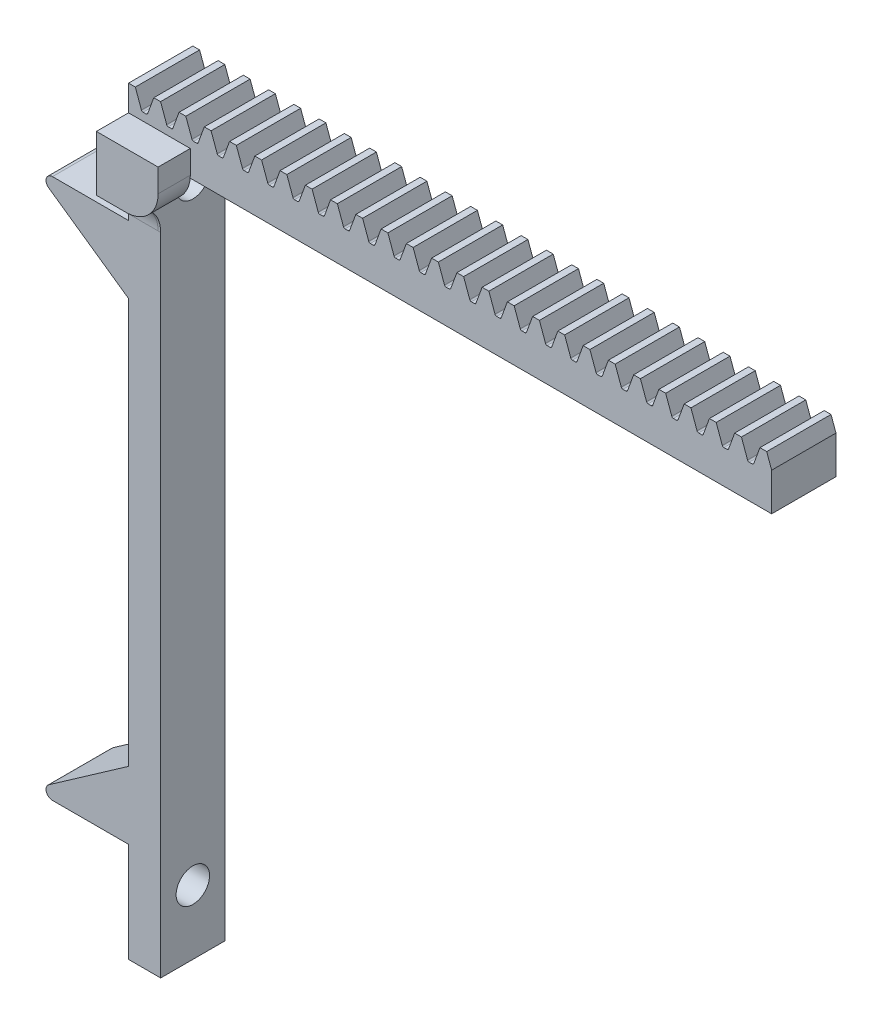
from build123d import *

# Parameters (mm, degrees)
SKETCH1_W           = 127
SKETCH1_H           = 10.16
BOSS_EXTRUDE1_DEPTH = 6.35
CUT_EXTRUDE1_DEPTH  = 12.7
FILLET3_R           = 0.320981709
LPATTERN4_START     = -6.35
LPATTERN4_DEPTH     = 12.7
SKETCH3_W           = 6.35
SKETCH3_H           = 12.7
BOSS_EXTRUDE2_DEPTH = 139.7
SKETCH4_R           = 3.302
CUT_EXTRUDE2_DEPTH  = 133.35
BOSS_EXTRUDE3_DEPTH = 12.7
FILLET6_R           = 1.27
SKETCH8_W           = 12.192
SKETCH8_H           = 10.922
BOSS_EXTRUDE4_DEPTH = 6.35
FILLET7_R           = 6.35
FILLET8_R           = 6.35


# Read off the part's stored shape, not the designer's step: LPattern4
with BuildPart() as part:
    # Sketch1 → Boss-Extrude1 (new, symmetric)
    with BuildSketch(Plane.XY):
        Rectangle(SKETCH1_W, SKETCH1_H)
    extrude(amount=BOSS_EXTRUDE1_DEPTH, both=True)

    # Sketch2 → Cut-Extrude1 (cut)
    with BuildSketch(Plane.XY.offset(6.35)):
        Polygon((-62.161960494, 5.08), (-60.872304763, 1.5367), (-59.802365731, 1.5367), (-58.51271, 5.08), align=None)
    extrude(amount=-CUT_EXTRUDE1_DEPTH, mode=Mode.SUBTRACT)

    # Fillet3
    fillet3_edges = [part.edges().sort_by_distance(p)[0] for p in [
        (-59.802365731, 1.5367, 0),
        (-60.872304763, 1.5367, 0),
    ]]
    fillet(fillet3_edges, radius=FILLET3_R)

    # LPattern4 outline → LPattern4 (cut)
    with BuildSketch(Plane.XY.offset(LPATTERN4_START)):
        with BuildLine():
            ThreePointArc((-55.961885094, 1.747899499), (-55.844368495, 1.594748886), (-55.66026095, 1.5367))
            Line((-55.66026095, 1.5367), (-55.039829544, 1.5367))
            ThreePointArc((-55.039829544, 1.5367), (-54.855721999, 1.594748886), (-54.7382054, 1.747899499))
            Line((-54.7382054, 1.747899499), (-53.52542, 5.08))
            Line((-53.52542, 5.08), (-57.174670494, 5.08))
            Line((-57.174670494, 5.08), (-55.961885094, 1.747899499))
        make_face()
        Polygon((63.5, 5.08), (62.520289506, 5.08), (63.5, 2.388267541), align=None)
        with BuildLine():
            Line((61.18225, 5.08), (57.532999506, 5.08))
            Line((57.532999506, 5.08), (58.745784906, 1.747899499))
            ThreePointArc((58.745784906, 1.747899499), (58.863301505, 1.594748886), (59.04740905, 1.5367))
            Line((59.04740905, 1.5367), (59.667840456, 1.5367))
            ThreePointArc((59.667840456, 1.5367), (59.851948001, 1.594748886), (59.9694646, 1.747899499))
            Line((59.9694646, 1.747899499), (61.18225, 5.08))
        make_face()
        with BuildLine():
            Line((56.19496, 5.08), (52.545709506, 5.08))
            Line((52.545709506, 5.08), (53.758494906, 1.747899499))
            ThreePointArc((53.758494906, 1.747899499), (53.876011505, 1.594748886), (54.06011905, 1.5367))
            Line((54.06011905, 1.5367), (54.680550456, 1.5367))
            ThreePointArc((54.680550456, 1.5367), (54.864658001, 1.594748886), (54.9821746, 1.747899499))
            Line((54.9821746, 1.747899499), (56.19496, 5.08))
        make_face()
        with BuildLine():
            Line((51.20767, 5.08), (47.558419506, 5.08))
            Line((47.558419506, 5.08), (48.771204906, 1.747899499))
            ThreePointArc((48.771204906, 1.747899499), (48.888721505, 1.594748886), (49.07282905, 1.5367))
            Line((49.07282905, 1.5367), (49.693260456, 1.5367))
            ThreePointArc((49.693260456, 1.5367), (49.877368001, 1.594748886), (49.9948846, 1.747899499))
            Line((49.9948846, 1.747899499), (51.20767, 5.08))
        make_face()
        with BuildLine():
            Line((46.22038, 5.08), (42.571129506, 5.08))
            Line((42.571129506, 5.08), (43.783914906, 1.747899499))
            ThreePointArc((43.783914906, 1.747899499), (43.901431505, 1.594748886), (44.08553905, 1.5367))
            Line((44.08553905, 1.5367), (44.705970456, 1.5367))
            ThreePointArc((44.705970456, 1.5367), (44.890078001, 1.594748886), (45.0075946, 1.747899499))
            Line((45.0075946, 1.747899499), (46.22038, 5.08))
        make_face()
        with BuildLine():
            Line((41.23309, 5.08), (37.583839506, 5.08))
            Line((37.583839506, 5.08), (38.796624906, 1.747899499))
            ThreePointArc((38.796624906, 1.747899499), (38.914141505, 1.594748886), (39.09824905, 1.5367))
            Line((39.09824905, 1.5367), (39.718680456, 1.5367))
            ThreePointArc((39.718680456, 1.5367), (39.902788001, 1.594748886), (40.0203046, 1.747899499))
            Line((40.0203046, 1.747899499), (41.23309, 5.08))
        make_face()
        with BuildLine():
            Line((36.2458, 5.08), (32.596549506, 5.08))
            Line((32.596549506, 5.08), (33.809334906, 1.747899499))
            ThreePointArc((33.809334906, 1.747899499), (33.926851505, 1.594748886), (34.11095905, 1.5367))
            Line((34.11095905, 1.5367), (34.731390456, 1.5367))
            ThreePointArc((34.731390456, 1.5367), (34.915498001, 1.594748886), (35.0330146, 1.747899499))
            Line((35.0330146, 1.747899499), (36.2458, 5.08))
        make_face()
        with BuildLine():
            Line((31.25851, 5.08), (27.609259506, 5.08))
            Line((27.609259506, 5.08), (28.822044906, 1.747899499))
            ThreePointArc((28.822044906, 1.747899499), (28.939561505, 1.594748886), (29.12366905, 1.5367))
            Line((29.12366905, 1.5367), (29.744100456, 1.5367))
            ThreePointArc((29.744100456, 1.5367), (29.928208001, 1.594748886), (30.0457246, 1.747899499))
            Line((30.0457246, 1.747899499), (31.25851, 5.08))
        make_face()
        with BuildLine():
            Line((26.27122, 5.08), (22.621969506, 5.08))
            Line((22.621969506, 5.08), (23.834754906, 1.747899499))
            ThreePointArc((23.834754906, 1.747899499), (23.952271505, 1.594748886), (24.13637905, 1.5367))
            Line((24.13637905, 1.5367), (24.756810456, 1.5367))
            ThreePointArc((24.756810456, 1.5367), (24.940918001, 1.594748886), (25.0584346, 1.747899499))
            Line((25.0584346, 1.747899499), (26.27122, 5.08))
        make_face()
        with BuildLine():
            Line((21.28393, 5.08), (17.634679506, 5.08))
            Line((17.634679506, 5.08), (18.847464906, 1.747899499))
            ThreePointArc((18.847464906, 1.747899499), (18.964981505, 1.594748886), (19.14908905, 1.5367))
            Line((19.14908905, 1.5367), (19.769520456, 1.5367))
            ThreePointArc((19.769520456, 1.5367), (19.953628001, 1.594748886), (20.0711446, 1.747899499))
            Line((20.0711446, 1.747899499), (21.28393, 5.08))
        make_face()
        with BuildLine():
            Line((16.29664, 5.08), (12.647389506, 5.08))
            Line((12.647389506, 5.08), (13.860174906, 1.747899499))
            ThreePointArc((13.860174906, 1.747899499), (13.977691505, 1.594748886), (14.16179905, 1.5367))
            Line((14.16179905, 1.5367), (14.782230456, 1.5367))
            ThreePointArc((14.782230456, 1.5367), (14.966338001, 1.594748886), (15.0838546, 1.747899499))
            Line((15.0838546, 1.747899499), (16.29664, 5.08))
        make_face()
        with BuildLine():
            Line((11.30935, 5.08), (7.660099506, 5.08))
            Line((7.660099506, 5.08), (8.872884906, 1.747899499))
            ThreePointArc((8.872884906, 1.747899499), (8.990401505, 1.594748886), (9.17450905, 1.5367))
            Line((9.17450905, 1.5367), (9.794940456, 1.5367))
            ThreePointArc((9.794940456, 1.5367), (9.979048001, 1.594748886), (10.0965646, 1.747899499))
            Line((10.0965646, 1.747899499), (11.30935, 5.08))
        make_face()
        with BuildLine():
            Line((6.32206, 5.08), (2.672809506, 5.08))
            Line((2.672809506, 5.08), (3.885594906, 1.747899499))
            ThreePointArc((3.885594906, 1.747899499), (4.003111505, 1.594748886), (4.18721905, 1.5367))
            Line((4.18721905, 1.5367), (4.807650456, 1.5367))
            ThreePointArc((4.807650456, 1.5367), (4.991758001, 1.594748886), (5.1092746, 1.747899499))
            Line((5.1092746, 1.747899499), (6.32206, 5.08))
        make_face()
        with BuildLine():
            Line((1.33477, 5.08), (-2.314480494, 5.08))
            Line((-2.314480494, 5.08), (-1.101695094, 1.747899499))
            ThreePointArc((-1.101695094, 1.747899499), (-0.984178495, 1.594748886), (-0.80007095, 1.5367))
            Line((-0.80007095, 1.5367), (-0.179639544, 1.5367))
            ThreePointArc((-0.179639544, 1.5367), (0.004468001, 1.594748886), (0.1219846, 1.747899499))
            Line((0.1219846, 1.747899499), (1.33477, 5.08))
        make_face()
        with BuildLine():
            Line((-3.65252, 5.08), (-7.301770494, 5.08))
            Line((-7.301770494, 5.08), (-6.088985094, 1.747899499))
            ThreePointArc((-6.088985094, 1.747899499), (-5.971468495, 1.594748886), (-5.78736095, 1.5367))
            Line((-5.78736095, 1.5367), (-5.166929544, 1.5367))
            ThreePointArc((-5.166929544, 1.5367), (-4.982821999, 1.594748886), (-4.8653054, 1.747899499))
            Line((-4.8653054, 1.747899499), (-3.65252, 5.08))
        make_face()
        with BuildLine():
            Line((-8.63981, 5.08), (-12.289060494, 5.08))
            Line((-12.289060494, 5.08), (-11.076275094, 1.747899499))
            ThreePointArc((-11.076275094, 1.747899499), (-10.958758495, 1.594748886), (-10.77465095, 1.5367))
            Line((-10.77465095, 1.5367), (-10.154219544, 1.5367))
            ThreePointArc((-10.154219544, 1.5367), (-9.970111999, 1.594748886), (-9.8525954, 1.747899499))
            Line((-9.8525954, 1.747899499), (-8.63981, 5.08))
        make_face()
        with BuildLine():
            Line((-13.6271, 5.08), (-17.276350494, 5.08))
            Line((-17.276350494, 5.08), (-16.063565094, 1.747899499))
            ThreePointArc((-16.063565094, 1.747899499), (-15.946048495, 1.594748886), (-15.76194095, 1.5367))
            Line((-15.76194095, 1.5367), (-15.141509544, 1.5367))
            ThreePointArc((-15.141509544, 1.5367), (-14.957401999, 1.594748886), (-14.8398854, 1.747899499))
            Line((-14.8398854, 1.747899499), (-13.6271, 5.08))
        make_face()
        with BuildLine():
            Line((-18.61439, 5.08), (-22.263640494, 5.08))
            Line((-22.263640494, 5.08), (-21.050855094, 1.747899499))
            ThreePointArc((-21.050855094, 1.747899499), (-20.933338495, 1.594748886), (-20.74923095, 1.5367))
            Line((-20.74923095, 1.5367), (-20.128799544, 1.5367))
            ThreePointArc((-20.128799544, 1.5367), (-19.944691999, 1.594748886), (-19.8271754, 1.747899499))
            Line((-19.8271754, 1.747899499), (-18.61439, 5.08))
        make_face()
        with BuildLine():
            Line((-23.60168, 5.08), (-27.250930494, 5.08))
            Line((-27.250930494, 5.08), (-26.038145094, 1.747899499))
            ThreePointArc((-26.038145094, 1.747899499), (-25.920628495, 1.594748886), (-25.73652095, 1.5367))
            Line((-25.73652095, 1.5367), (-25.116089544, 1.5367))
            ThreePointArc((-25.116089544, 1.5367), (-24.931981999, 1.594748886), (-24.8144654, 1.747899499))
            Line((-24.8144654, 1.747899499), (-23.60168, 5.08))
        make_face()
        with BuildLine():
            Line((-28.58897, 5.08), (-32.238220494, 5.08))
            Line((-32.238220494, 5.08), (-31.025435094, 1.747899499))
            ThreePointArc((-31.025435094, 1.747899499), (-30.907918495, 1.594748886), (-30.72381095, 1.5367))
            Line((-30.72381095, 1.5367), (-30.103379544, 1.5367))
            ThreePointArc((-30.103379544, 1.5367), (-29.919271999, 1.594748886), (-29.8017554, 1.747899499))
            Line((-29.8017554, 1.747899499), (-28.58897, 5.08))
        make_face()
        with BuildLine():
            Line((-33.57626, 5.08), (-37.225510494, 5.08))
            Line((-37.225510494, 5.08), (-36.012725094, 1.747899499))
            ThreePointArc((-36.012725094, 1.747899499), (-35.895208495, 1.594748886), (-35.71110095, 1.5367))
            Line((-35.71110095, 1.5367), (-35.090669544, 1.5367))
            ThreePointArc((-35.090669544, 1.5367), (-34.906561999, 1.594748886), (-34.7890454, 1.747899499))
            Line((-34.7890454, 1.747899499), (-33.57626, 5.08))
        make_face()
        with BuildLine():
            Line((-38.56355, 5.08), (-42.212800494, 5.08))
            Line((-42.212800494, 5.08), (-41.000015094, 1.747899499))
            ThreePointArc((-41.000015094, 1.747899499), (-40.882498495, 1.594748886), (-40.69839095, 1.5367))
            Line((-40.69839095, 1.5367), (-40.077959544, 1.5367))
            ThreePointArc((-40.077959544, 1.5367), (-39.893851999, 1.594748886), (-39.7763354, 1.747899499))
            Line((-39.7763354, 1.747899499), (-38.56355, 5.08))
        make_face()
        with BuildLine():
            Line((-43.55084, 5.08), (-47.200090494, 5.08))
            Line((-47.200090494, 5.08), (-45.987305094, 1.747899499))
            ThreePointArc((-45.987305094, 1.747899499), (-45.869788495, 1.594748886), (-45.68568095, 1.5367))
            Line((-45.68568095, 1.5367), (-45.065249544, 1.5367))
            ThreePointArc((-45.065249544, 1.5367), (-44.881141999, 1.594748886), (-44.7636254, 1.747899499))
            Line((-44.7636254, 1.747899499), (-43.55084, 5.08))
        make_face()
        with BuildLine():
            Line((-48.53813, 5.08), (-52.187380494, 5.08))
            Line((-52.187380494, 5.08), (-50.974595094, 1.747899499))
            ThreePointArc((-50.974595094, 1.747899499), (-50.857078495, 1.594748886), (-50.67297095, 1.5367))
            Line((-50.67297095, 1.5367), (-50.052539544, 1.5367))
            ThreePointArc((-50.052539544, 1.5367), (-49.868431999, 1.594748886), (-49.7509154, 1.747899499))
            Line((-49.7509154, 1.747899499), (-48.53813, 5.08))
        make_face()
    extrude(amount=LPATTERN4_DEPTH, mode=Mode.SUBTRACT)

    # Sketch3 → Boss-Extrude2 (add)
    with BuildSketch(Plane.XZ.offset(5.08)):
        with Locations((-60.325, 0)):
            Rectangle(SKETCH3_W, SKETCH3_H)
    extrude(amount=BOSS_EXTRUDE2_DEPTH)

    # Sketch4 → Cut-Extrude2 (cut)
    with BuildSketch(Plane(origin=(-57.15, 0, 0), x_dir=(0, 0, -1), z_dir=(1, 0, 0))):
        with Locations(Location((0, -11.43, 0), (0, 0, 90))):
            Circle(SKETCH4_R)
        with Locations(Location((0, -132.08, 0), (0, 0, 90))):
            Circle(SKETCH4_R)
    extrude(amount=-CUT_EXTRUDE2_DEPTH, mode=Mode.SUBTRACT)

    # Sketch7 → Boss-Extrude3 (add)
    with BuildSketch(Plane.XY.offset(6.35)):
        Polygon((-63.5, -18.415), (-82.55, -18.415), (-63.5, -31.75), align=None)
        Polygon((-63.5, -111.76), (-63.5, -125.095), (-82.55, -125.095), align=None)
    extrude(amount=-BOSS_EXTRUDE3_DEPTH)

    # Fillet6
    fillet6_edges = [part.edges().sort_by_distance(p)[0] for p in [
        (-82.55, -18.415, 0),
        (-82.55, -125.095, 0),
    ]]
    fillet(fillet6_edges, radius=FILLET6_R)

    # Sketch8 → Boss-Extrude4 (add)
    with BuildSketch(Plane.XY.offset(6.35)):
        with Locations((-57.404, -5.461)):
            Rectangle(SKETCH8_W, SKETCH8_H)
    extrude(amount=BOSS_EXTRUDE4_DEPTH)

    # Fillet7
    # the kernel refuses this fillet: 6.35 mm, written as the material it takes off along each edge
    with BuildSketch(Plane(origin=(-51.308, -10.922, 6.35), x_dir=(-1, 0, 0), z_dir=(0, 0, 1))) as fillet7_piece_1:
        with BuildLine():
            CenterArc((FILLET7_R, -FILLET7_R), FILLET7_R, 90, 90)
            Line((0, -FILLET7_R), (0, 0))
            Line((0, 0), (FILLET7_R, 0))
        make_face()
    extrude(amount=22.225, mode=Mode.SUBTRACT)

    # Fillet8
    # the kernel refuses this fillet: 6.35 mm, written as the material it adds along each edge
    with BuildSketch(Plane(origin=(-57.658, -4.572, 6.35), x_dir=(0, -1, 0), z_dir=(-1, 0, 0))) as fillet8_piece_1_section:
        with BuildLine():
            CenterArc((6.35 + FILLET8_R, FILLET8_R), FILLET8_R, 180, 90)
            Line((6.35 + FILLET8_R, 0), (6.35 + FILLET8_R, -FILLET8_R * 0.02))
            Line((6.35 + FILLET8_R, -FILLET8_R * 0.02), (6.35 - FILLET8_R * 0.02, -FILLET8_R * 0.02))
            Line((6.35 - FILLET8_R * 0.02, -FILLET8_R * 0.02), (6.35 - FILLET8_R * 0.02, FILLET8_R))
            Line((6.35 - FILLET8_R * 0.02, FILLET8_R), (6.35, FILLET8_R))
        make_face()
    fillet8_piece_1 = revolve(axis=Axis((-57.658, -4.572, 6.35), (0, 0, 1)), revolution_arc=147.828164046, mode=Mode.PRIVATE)
    fillet8_piece_1 = split(fillet8_piece_1, bisect_by=Plane(origin=(-57.403899991, -12.208041072, 6.35), z_dir=(0, 0, 1)), keep=Keep.TOP, mode=Mode.PRIVATE)
    fillet8_piece_1 = split(fillet8_piece_1, bisect_by=Plane(origin=(-57.15, -12.208041072, 7.918319396), z_dir=(-1, 0, 0)), keep=Keep.TOP, mode=Mode.PRIVATE)
    add(fillet8_piece_1)
    with BuildSketch(Plane(origin=(-57.658, -10.922, 6.35), x_dir=(0, 0, 1), z_dir=(-1, 0, 0))) as fillet8_piece_2:
        with BuildLine():
            CenterArc((FILLET8_R, -FILLET8_R), FILLET8_R, 90, 90)
            Line((0, -FILLET8_R), (-FILLET8_R * 0.02, -FILLET8_R))
            Line((-FILLET8_R * 0.02, -FILLET8_R), (-FILLET8_R * 0.02, FILLET8_R * 0.02))
            Line((-FILLET8_R * 0.02, FILLET8_R * 0.02), (FILLET8_R, FILLET8_R * 0.02))
            Line((FILLET8_R, FILLET8_R * 0.02), (FILLET8_R, 0))
        make_face()
    extrude(amount=5.842)


solid = part.part
